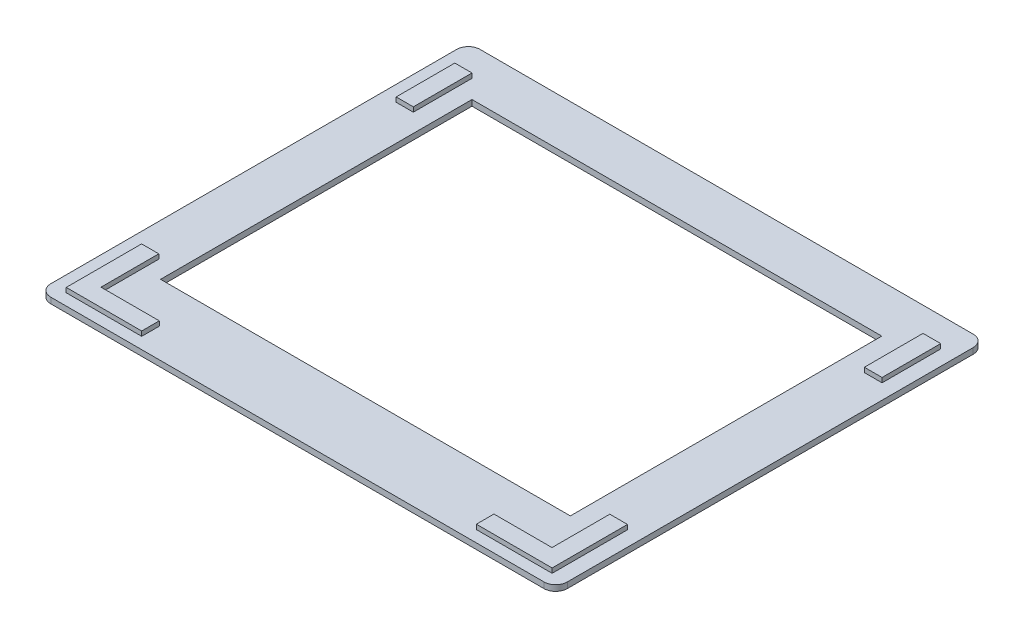
from build123d import *

# Parameters (mm, degrees)
BOSS_EXTRUDE2_DEPTH   = 1.016
BOSS_EXTRUDE2_2_DEPTH = 1.016
SKETCH2_W             = 3.747831998
SKETCH2_H             = 12.799678195
BOSS_EXTRUDE2_3_DEPTH = 1.016
SKETCH2_W_2           = 3.862926877
BOSS_EXTRUDE2_4_DEPTH = 1.016
SKETCH2_7_W           = 112.7125
SKETCH2_7_H           = 93.6625
BOSS_EXTRUDE14_DEPTH  = 1.27
SKETCH2_8_W           = 89.425
SKETCH2_8_H           = 67.9625
CUT_EXTRUDE4_DEPTH    = 1.27
FILLET1_R             = 2.54
FILLET2_R             = 2.54
FILLET3_R             = 2.54
FILLET4_R             = 2.54


with BuildPart() as part:
    # Sketch2 → Boss-Extrude2 (new body)
    with BuildSketch(Plane(origin=(0, 0, 0), x_dir=(1, 0, 0), z_dir=(0, 1, 0))):
        Polygon((-52.960331998, -27.870210865), (-52.960331998, -44.318627665), (-36.491625106, -44.318627665), (-36.491625106, -40.48125), (-49.2125, -40.48125), (-49.2125, -27.870210865), align=None)
    extrude(amount=BOSS_EXTRUDE2_DEPTH)



with BuildPart() as body_2:
    # Sketch2 → Boss-Extrude2 2 (new body)
    with BuildSketch(Plane(origin=(0, 0, 0), x_dir=(1, 0, 0), z_dir=(0, 1, 0))):
        Polygon((49.2125, -40.48125), (36.537927314, -40.48125), (36.537927314, -44.318627665), (53.075426877, -44.318627665), (53.075426877, -27.870210865), (49.2125, -27.870210865), align=None)
    extrude(amount=BOSS_EXTRUDE2_2_DEPTH)


with BuildPart() as body_3:
    # Sketch2 → Boss-Extrude2 3 (new body)
    with BuildSketch(Plane(origin=(0, 0, 0), x_dir=(1, 0, 0), z_dir=(0, 1, 0))):
        with Locations((-51.086415999, 34.081410903)):
            Rectangle(SKETCH2_W, SKETCH2_H)
    extrude(amount=BOSS_EXTRUDE2_3_DEPTH)


with BuildPart() as body_4:
    # Sketch2 → Boss-Extrude2 4 (new body)
    with BuildSketch(Plane(origin=(0, 0, 0), x_dir=(1, 0, 0), z_dir=(0, 1, 0))):
        with Locations((51.143963439, 34.081410903)):
            Rectangle(SKETCH2_W_2, SKETCH2_H)
    extrude(amount=BOSS_EXTRUDE2_4_DEPTH)


with BuildPart() as part_1:
    add(part.part)

    add(body_2.part)  # Boss-Extrude14 merges body 2

    add(body_3.part)  # Boss-Extrude14 merges body 3

    add(body_4.part)  # Boss-Extrude14 merges body 4
    # Sketch2<7> → Boss-Extrude14 (add)
    with BuildSketch(Plane(origin=(0, 0, 0), x_dir=(1, 0, 0), z_dir=(0, 1, 0))):
        Rectangle(SKETCH2_7_W, SKETCH2_7_H)
    extrude(amount=-BOSS_EXTRUDE14_DEPTH)

    # Sketch2<8> → Cut-Extrude4 (cut)
    with BuildSketch(Plane(origin=(0, 0, 0), x_dir=(1, 0, 0), z_dir=(0, 1, 0))):
        with Locations((-0.5, 2.5)):
            Rectangle(SKETCH2_8_W, SKETCH2_8_H)
    extrude(amount=-CUT_EXTRUDE4_DEPTH, mode=Mode.SUBTRACT)

    # Fillet1
    fillet1_edges = [part_1.edges().sort_by_distance(p)[0] for p in [
        (-56.35625, -0.635, -46.83125),
    ]]
    fillet(fillet1_edges, radius=FILLET1_R)

    # Fillet2
    fillet2_edges = [part_1.edges().sort_by_distance(p)[0] for p in [
        (56.35625, -0.635, -46.83125),
    ]]
    fillet(fillet2_edges, radius=FILLET2_R)

    # Fillet3
    fillet3_edges = [part_1.edges().sort_by_distance(p)[0] for p in [
        (56.35625, -0.635, 46.83125),
    ]]
    fillet(fillet3_edges, radius=FILLET3_R)

    # Fillet4
    fillet4_edges = [part_1.edges().sort_by_distance(p)[0] for p in [
        (-56.35625, -0.635, 46.83125),
    ]]
    fillet(fillet4_edges, radius=FILLET4_R)


solid = part_1.part
